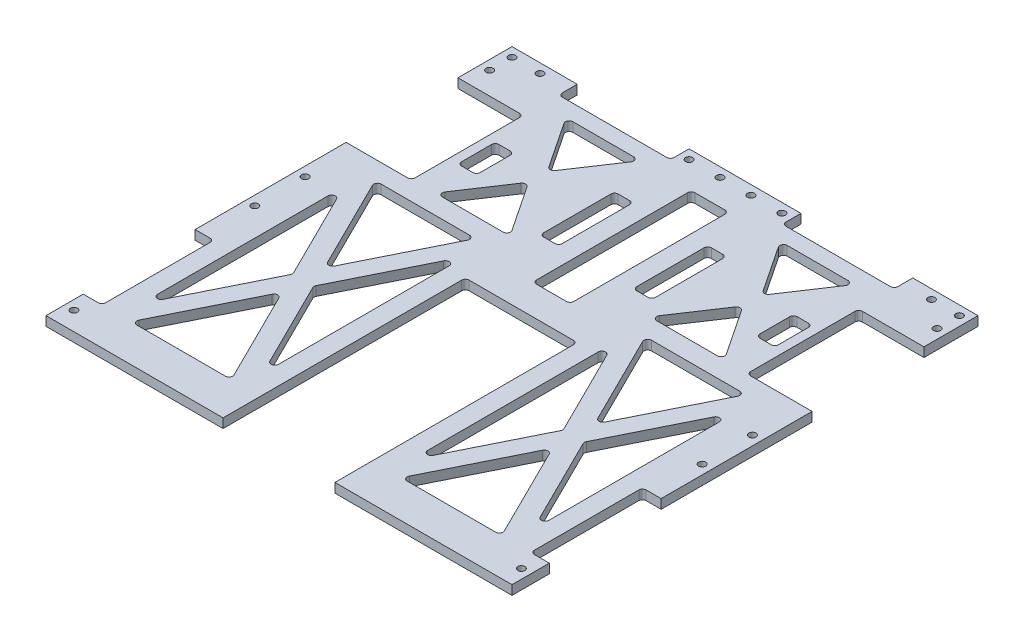
from build123d import *

# Parameters (mm, degrees)
BOSS_EXTRUDE1_DEPTH = 6.35
SKETCH2_W           = 44.45
SKETCH2_H           = 76.2
SKETCH2_W_2         = 12.7
SKETCH2_W_3         = 76.2
SKETCH2_H_2         = 12.7
CUT_EXTRUDE1_DEPTH  = 289.907554418
CUT_EXTRUDE3_DEPTH  = 289.907554418
SKETCH3_W           = 12.7
SKETCH3_H           = 50.8
SKETCH3_H_2         = 25.4
CUT_EXTRUDE2_DEPTH  = 289.907554418
SKETCH7_R           = 2.413
CUT_EXTRUDE6_DEPTH  = 289.907554418
SKETCH12_W          = 25.4
SKETCH12_H          = 107.95
CUT_EXTRUDE9_DEPTH  = 289.907554418
FILLET1_R           = 2.54
FILLET2_R           = 2.54
FILLET3_R           = 2.54


with BuildPart() as part:
    # Sketch1 → Boss-Extrude1 (new body)
    with BuildSketch(Plane(origin=(0, 0, 0), x_dir=(1, 0, 0), z_dir=(0, 1, 0))):
        Polygon((-158.75, 76.2), (-158.75, -241.3), (-38.1, -241.3), (-38.1, -76.2), (38.1, -76.2), (38.1, -241.3), (158.75, -241.3), (158.75, 76.2), align=None)
    extrude(amount=BOSS_EXTRUDE1_DEPTH)

    # Sketch2 → Cut-Extrude1 (cut, through all)
    with BuildSketch(Plane(origin=(0, 6.35, 0), x_dir=(1, 0, 0), z_dir=(0, 1, 0))):
        with Locations((136.525, 1.27)):
            Rectangle(SKETCH2_W, SKETCH2_H)
        with Locations((152.4, -177.8)):
            Rectangle(SKETCH2_W_2, SKETCH2_H)
        with Locations((-152.4, -177.8)):
            Rectangle(SKETCH2_W_2, SKETCH2_H)
        with Locations((-136.525, 1.27)):
            Rectangle(SKETCH2_W, SKETCH2_H)
        with Locations((-76.2, 69.85)):
            Rectangle(SKETCH2_W_3, SKETCH2_H_2)
        with Locations((76.2, 69.85)):
            Rectangle(SKETCH2_W_3, SKETCH2_H_2)
    extrude(amount=-CUT_EXTRUDE1_DEPTH, mode=Mode.SUBTRACT)

    # Sketch4 → Cut-Extrude3 (cut, through all)
    with BuildSketch(Plane(origin=(0, 6.35, 0), x_dir=(1, 0, 0), z_dir=(0, 1, 0))):
        Polygon((92.075, -147.001477117), (57.88871002, -215.9), (126.26128998, -215.9), align=None)
        Polygon((50.8, -63.816477117), (50.8, -201.613522883), (84.98628998, -132.715), align=None)
        Polygon((133.35, -63.816477117), (99.16371002, -132.715), (133.35, -201.613522883), align=None)
        Polygon((57.88871002, -49.53), (92.075, -118.428522883), (126.26128998, -49.53), align=None)
        Polygon((-84.98628998, -132.715), (-50.8, -201.613522883), (-50.8, -63.816477117), align=None)
        Polygon((-126.26128998, -49.53), (-92.075, -118.428522883), (-57.88871002, -49.53), align=None)
        Polygon((-57.88871002, -215.9), (-92.075, -147.001477117), (-126.26128998, -215.9), align=None)
        Polygon((-133.35, -201.613522883), (-99.16371002, -132.715), (-133.35, -63.816477117), align=None)
    extrude(amount=-CUT_EXTRUDE3_DEPTH, mode=Mode.SUBTRACT)

    # Sketch3 → Cut-Extrude2 (cut, through all)
    with BuildSketch(Plane(origin=(0, 6.35, 0), x_dir=(1, 0, 0), z_dir=(0, 1, 0))):
        with Locations((-31.75, 0)):
            Rectangle(SKETCH3_W, SKETCH3_H)
        with Locations((31.75, 0)):
            Rectangle(SKETCH3_W, SKETCH3_H)
        with Locations((101.6, 1.27)):
            Rectangle(SKETCH3_W, SKETCH3_H_2)
        with Locations((-101.6, 1.27)):
            Rectangle(SKETCH3_W, SKETCH3_H_2)
    extrude(amount=-CUT_EXTRUDE2_DEPTH, mode=Mode.SUBTRACT)

    # Sketch7 → Cut-Extrude6 (cut, through all)
    with BuildSketch(Plane(origin=(0, 6.35, 0), x_dir=(1, 0, 0), z_dir=(0, 1, 0))):
        with Locations((152.4, -105.41)):
            Circle(SKETCH7_R)
        with Locations((152.4, -71.12)):
            Circle(SKETCH7_R)
        with Locations((152.4, -228.6)):
            Circle(SKETCH7_R)
        with Locations((152.4, 69.85)):
            Circle(SKETCH7_R)
        with Locations((133.35, 69.85)):
            Circle(SKETCH7_R)
        with Locations((152.4, 54.61)):
            Circle(SKETCH7_R)
        with Locations((-152.4, -228.6)):
            Circle(SKETCH7_R)
        with Locations((-31.75, 69.85)):
            Circle(SKETCH7_R)
        with Locations((-10.668, 69.85)):
            Circle(SKETCH7_R)
        with Locations((10.414, 69.85)):
            Circle(SKETCH7_R)
        with Locations((31.496, 69.85)):
            Circle(SKETCH7_R)
        with Locations((-152.4, 54.61)):
            Circle(SKETCH7_R)
        with Locations((-133.35, 69.85)):
            Circle(SKETCH7_R)
        with Locations((-152.4, 69.85)):
            Circle(SKETCH7_R)
        with Locations((-152.4, -71.12)):
            Circle(SKETCH7_R)
        with Locations((-152.4, -105.41)):
            Circle(SKETCH7_R)
    extrude(amount=-CUT_EXTRUDE6_DEPTH, mode=Mode.SUBTRACT)

    # Sketch12 → Cut-Extrude9 (cut, through all)
    with BuildSketch(Plane(origin=(0, 6.35, 0), x_dir=(1, 0, 0), z_dir=(0, 1, 0))):
        Polygon((-98.425, 52.614228607), (-47.625, 52.614228607), (-73.025, 14.514228607), align=None)
        Polygon((-47.625, -36.285771393), (-73.025, 1.814228607), (-98.425, -36.285771393), align=None)
        Polygon((73.025, 1.814228607), (98.425, -36.285771393), (47.625, -36.285771393), align=None)
        Polygon((73.025, 14.514228607), (98.425, 52.614228607), (47.625, 52.614228607), align=None)
        with Locations((0, -1.679180184)):
            Rectangle(SKETCH12_W, SKETCH12_H)
    extrude(amount=-CUT_EXTRUDE9_DEPTH, mode=Mode.SUBTRACT)

    # Fillet1
    fillet1_edges = [part.edges().sort_by_distance(p)[0] for p in [
        (-12.7, 3.175, 55.654180184),
        (-12.7, 3.175, -52.295819816),
        (-133.35, 3.175, 63.816477117),
        (-133.35, 3.175, 201.613522883),
        (-126.26128998, 3.175, 215.9),
        (-57.88871002, 3.175, 215.9),
        (-92.075, 3.175, 147.001477117),
        (-84.98628998, 3.175, 132.715),
        (-50.8, 3.175, 63.816477117),
        (-50.8, 3.175, 201.613522883),
        (-92.075, 3.175, 118.428522883),
        (-99.16371002, 3.175, 132.715),
        (-57.88871002, 3.175, 49.53),
        (-126.26128998, 3.175, 49.53),
        (-98.425, 3.175, 36.285771393),
        (-47.625, 3.175, 36.285771393),
        (-73.025, 3.175, -1.814228607),
        (-73.025, 3.175, -14.514228607),
        (-47.625, 3.175, -52.614228607),
        (-98.425, 3.175, -52.614228607),
    ]]
    fillet(fillet1_edges, radius=FILLET1_R)

    # Fillet2
    fillet2_edges = [part.edges().sort_by_distance(p)[0] for p in [
        (50.8, 3.175, 63.816477117),
        (133.35, 3.175, 63.816477117),
        (92.075, 3.175, 147.001477117),
        (99.16371002, 3.175, 132.715),
        (50.8, 3.175, 201.613522883),
        (57.88871002, 3.175, 215.9),
        (133.35, 3.175, 201.613522883),
        (84.98628998, 3.175, 132.715),
        (126.26128998, 3.175, 215.9),
        (92.075, 3.175, 118.428522883),
        (57.88871002, 3.175, 49.53),
        (126.26128998, 3.175, 49.53),
        (73.025, 3.175, -1.814228607),
        (47.625, 3.175, 36.285771393),
        (98.425, 3.175, 36.285771393),
        (98.425, 3.175, -52.614228607),
        (73.025, 3.175, -14.514228607),
        (12.7, 3.175, 55.654180184),
        (12.7, 3.175, -52.295819816),
        (47.625, 3.175, -52.614228607),
    ]]
    fillet(fillet2_edges, radius=FILLET2_R)

    # Fillet3
    fillet3_edges = [part.edges().sort_by_distance(p)[0] for p in [
        (-107.95, 3.175, 11.43),
        (-95.25, 3.175, 11.43),
        (-95.25, 3.175, -13.97),
        (-107.95, 3.175, -13.97),
        (95.25, 3.175, 11.43),
        (107.95, 3.175, 11.43),
        (107.95, 3.175, -13.97),
        (95.25, 3.175, -13.97),
        (114.3, 3.175, -63.5),
        (38.1, 3.175, -63.5),
        (-38.1, 3.175, -63.5),
        (-114.3, 3.175, -63.5),
        (146.05, 3.175, 215.9),
        (146.05, 3.175, 139.7),
        (-146.05, 3.175, 215.9),
        (-146.05, 3.175, 139.7),
        (38.1, 3.175, 76.2),
        (-38.1, 3.175, 76.2),
        (-114.3, 3.175, 36.83),
        (-114.3, 3.175, -39.37),
        (114.3, 3.175, -39.37),
        (114.3, 3.175, 36.83),
        (-25.4, 3.175, 25.4),
        (-38.1, 3.175, 25.4),
        (-38.1, 3.175, -25.4),
        (-25.4, 3.175, -25.4),
        (25.4, 3.175, 25.4),
        (38.1, 3.175, 25.4),
        (38.1, 3.175, -25.4),
        (25.4, 3.175, -25.4),
    ]]
    fillet(fillet3_edges, radius=FILLET3_R)


solid = part.part
